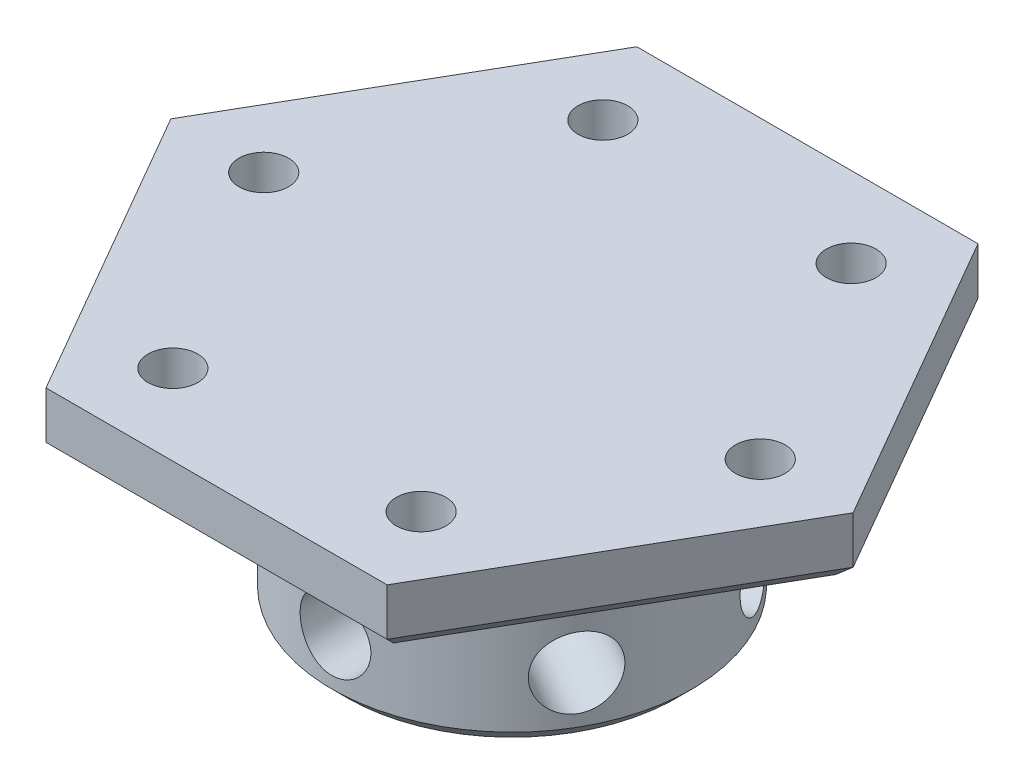
from build123d import *

# Parameters (mm, degrees)
EXTRUDE_1_DEPTH          = 1.25
SKETCH_2_R               = 7.25
EXTRUDE_2_DEPTH          = 7.5
SKETCH_3_R               = 1.425
CUT_EXTRUDE_1_DEPTH      = 32.199772969
PATTERN_CIRCULAR_1_COUNT = 3
CHAMFER_1_SIZE           = 0.6
SKETCH_4_R               = 1
CUT_EXTRUDE_2_DEPTH      = 21.746646315


with BuildPart() as part:
    # 草图1 → 凸台-拉伸1 (new, symmetric)
    with BuildSketch(Plane(origin=(0, 0, 0), x_dir=(1, 0, 0), z_dir=(0, 1, 0))):
        Polygon((13.740936407, 0), (6.870468203, 11.9), (-6.870468203, 11.9), (-13.740936407, 0), (-6.870468203, -11.9), (6.870468203, -11.9), align=None)
    extrude(amount=EXTRUDE_1_DEPTH, both=True)

    # 草图2 → 凸台-拉伸2 (add)
    with BuildSketch(Plane.XZ.offset(1.25)):
        Circle(SKETCH_2_R)
    extrude(amount=EXTRUDE_2_DEPTH)

    # 草图3 → 切除-拉伸1 (cut, through all)
    with BuildSketch(Plane(origin=(-10.305702305, 0, 5.95), x_dir=(0.5000000000000071, 0, 0.8660254037844346), z_dir=(-0.8660254037844346, 0, 0.5000000000000071))):
        with Locations((0, -6.25)):
            Circle(SKETCH_3_R)
    cut_extrude_1 = extrude(amount=-CUT_EXTRUDE_1_DEPTH, mode=Mode.SUBTRACT)

    # 阵列(圆周)1: 切除-拉伸1 ×3 about axis
    pattern_circular_1_axis = Axis((0, -8.75, 0), (0, -1, 0))
    for i in range(1, PATTERN_CIRCULAR_1_COUNT):
        add(cut_extrude_1.rotate(pattern_circular_1_axis, i * 360 / PATTERN_CIRCULAR_1_COUNT), mode=Mode.SUBTRACT)

    # 倒角1
    chamfer_1_edges = [part.edges().sort_by_distance(p)[0] for p in [
        (-7.25, -8.75, 0),
        (10.305702305, -1.25, 5.95),
        (10.305702305, -1.25, -5.95),
        (0, -1.25, -11.9),
        (-10.305702305, -1.25, -5.95),
        (0, -1.25, 11.9),
        (-10.305702305, -1.25, 5.95),
    ]]
    chamfer(chamfer_1_edges, length=CHAMFER_1_SIZE)

    # 草图4 → 切除-拉伸2 (cut, through all)
    with BuildSketch(Plane(origin=(0, 1.25, 0), x_dir=(1, 0, 0), z_dir=(0, 1, 0))):
        with Locations((5, 8.660254038)):
            Circle(SKETCH_4_R)
        with Locations((10, 0)):
            Circle(SKETCH_4_R)
        with Locations((5, -8.660254038)):
            Circle(SKETCH_4_R)
        with Locations((-5, -8.660254038)):
            Circle(SKETCH_4_R)
        with Locations((-10, 0)):
            Circle(SKETCH_4_R)
        with Locations((-5, 8.660254038)):
            Circle(SKETCH_4_R)
    extrude(amount=-CUT_EXTRUDE_2_DEPTH, mode=Mode.SUBTRACT)


solid = part.part
